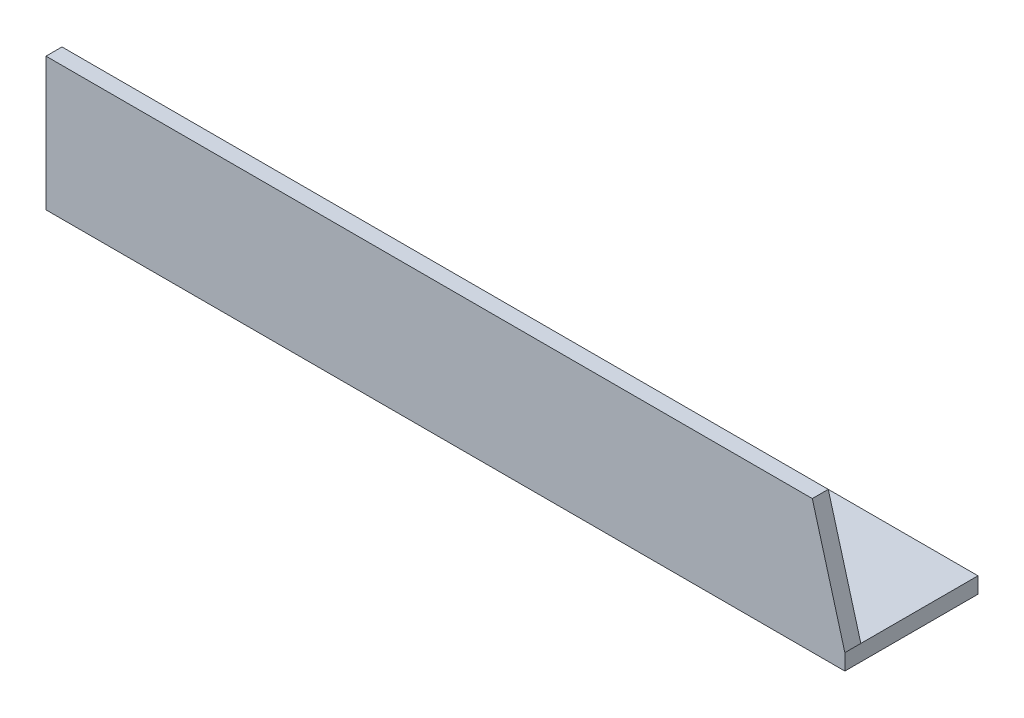
from build123d import *

# Parameters (mm, degrees)
EXTRUDE_1_DEPTH     = 300
CUT_EXTRUDE_1_DEPTH = 309.220700148


with BuildPart() as part:
    # Эскиз1 → Вытянуть-Тонкостенный1 (new body)
    with BuildSketch(Plane(origin=(0, 0, 0), x_dir=(0, 0, -1), z_dir=(1, 0, 0))):
        Polygon((0, 50), (0, 0), (50, 0), (50, 6), (6, 6), (6, 50), align=None)
    extrude(amount=EXTRUDE_1_DEPTH)

    # Эскиз2 → Вырез-Вытянуть1 (cut, through all)
    with BuildSketch(Plane.XY):
        Polygon((287.773512033, 50), (300, 50), (300, 6), align=None)
    extrude(amount=-CUT_EXTRUDE_1_DEPTH, mode=Mode.SUBTRACT)


solid = part.part
